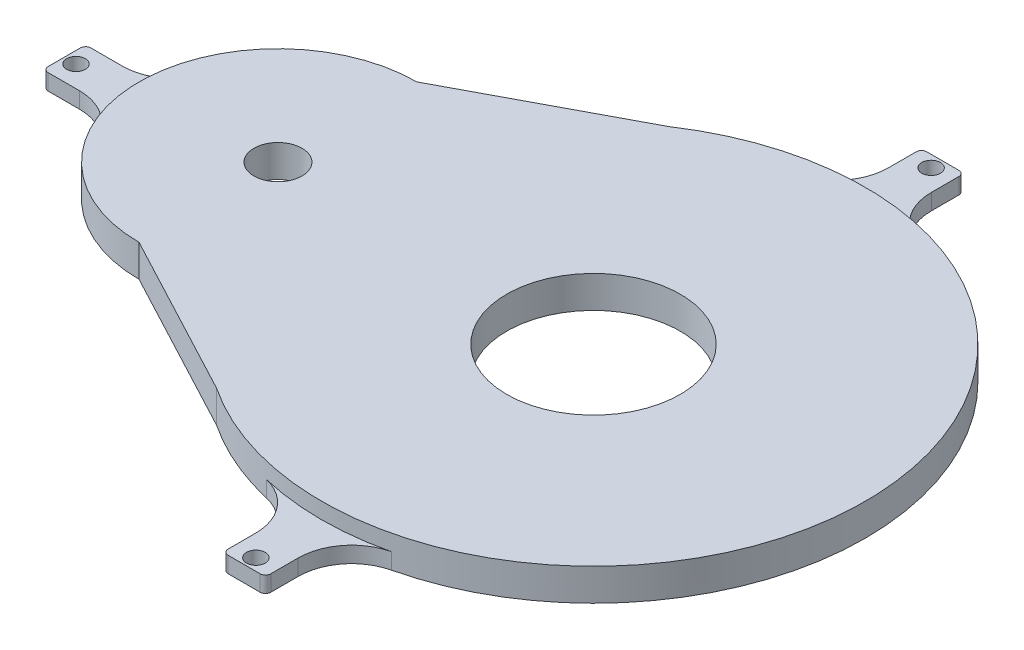
from build123d import *
from build123d.topology import SkipClean

# Parameters (mm, degrees)
SKETCH1_R           = 4.5
BOSS_EXTRUDE1_DEPTH = 6
BOSS_EXTRUDE5_DEPTH = 6
BOSS_EXTRUDE3_START = -6
BOSS_EXTRUDE3_DEPTH = 6
CUT_EXTRUDE1_START  = -3
CUT_EXTRUDE1_DEPTH  = 3
BOSS_EXTRUDE4_START = -6
BOSS_EXTRUDE4_DEPTH = 6
CUT_EXTRUDE2_START  = -3
CUT_EXTRUDE2_DEPTH  = 3
BOSS_EXTRUDE7_START = -3
BOSS_EXTRUDE7_DEPTH = 3
BOSS_EXTRUDE9_START = -6
BOSS_EXTRUDE9_DEPTH = 6
CUT_EXTRUDE4_START  = -3
CUT_EXTRUDE4_DEPTH  = 3
FILLET1_R           = 1
FILLET2_R           = 10
CUT_EXTRUDE5_START  = -6
CUT_EXTRUDE5_DEPTH  = 6
SKETCH1_6_R         = 16.25
SKETCH1_6_R_2       = 4.5
CUT_EXTRUDE8_DEPTH  = 10


with BuildPart() as part:
    # Sketch1 → Boss-Extrude1 (new body)
    with BuildSketch(Plane(origin=(0, 0, 0), x_dir=(1, 0, 0), z_dir=(0, 1, 0))):
        with BuildLine():
            Line((3.706249193, 49.435224426), (-27.146075319, 33.07485149))
            ThreePointArc((-27.146075319, 33.07485149), (-53.146075319, 7.07485149), (-27.146075319, -18.92514851))
            Line((-27.146075319, -18.92514851), (3.706249193, -35.285521446))
            ThreePointArc((3.706249193, -35.285521446), (82.798924681, 7.07485149), (3.706249193, 49.435224426))
        make_face()
        with Locations(Location((-27.146075319, 7.07485149, 0), (0, 0, 270))):
            Circle(SKETCH1_R, mode=Mode.SUBTRACT)
    extrude(amount=BOSS_EXTRUDE1_DEPTH)

    # Sketch1<3> → Boss-Extrude5 (add)
    with BuildSketch(Plane(origin=(0, 0, 0), x_dir=(1, 0, 0), z_dir=(0, 1, 0))):
        with BuildLine():
            ThreePointArc((-16.299337932, -9.227158073), (-13.7342993, -15.430441322), (-10.375107984, -21.242151909))
            Line((-10.375107984, -21.242151909), (3.706249193, -27.385705604))
            ThreePointArc((3.706249193, -27.385705604), (-5.156108472, -17.605185328), (-10.76229626, -5.656519346))
            ThreePointArc((-10.76229626, -5.656519346), (-12.682785992, -8.75689294), (-16.299337932, -9.227158073))
        make_face()
    extrude(amount=BOSS_EXTRUDE5_DEPTH)

    # Sketch2 → Boss-Extrude3 (add)
    with BuildSketch(Plane(origin=(0, 6, 0), x_dir=(1, 0, 0), z_dir=(0, 1, 0)).offset(BOSS_EXTRUDE3_START)):
        with BuildLine():
            ThreePointArc((-53.146075319, 7.07485149), (-53.068576106, 9.080830791), (-52.836540476, 11.07485149))
            Line((-52.836540476, 11.07485149), (-67.146075316, 11.07485149))
            Line((-67.146075316, 11.07485149), (-67.146075316, 7.07485149))
            Line((-67.146075316, 7.07485149), (-66.696075316, 7.07485149))
            ThreePointArc((-66.696075316, 7.07485149), (-64.946075316, 8.82485149), (-63.196075316, 7.07485149))
            Line((-63.196075316, 7.07485149), (-53.146075319, 7.07485149))
        make_face()
        with BuildLine():
            ThreePointArc((-52.836540476, 3.07485149), (-53.068576106, 5.06887219), (-53.146075319, 7.07485149))
            Line((-53.146075319, 7.07485149), (-63.196075316, 7.07485149))
            ThreePointArc((-63.196075316, 7.07485149), (-64.946075316, 5.32485149), (-66.696075316, 7.07485149))
            Line((-66.696075316, 7.07485149), (-67.146075316, 7.07485149))
            Line((-67.146075316, 7.07485149), (-67.146075316, 3.07485149))
            Line((-67.146075316, 3.07485149), (-52.836540476, 3.07485149))
        make_face()
        with BuildLine():
            Line((97.688924678, 11.07485149), (82.641479318, 11.07485149))
            ThreePointArc((82.641479318, 11.07485149), (82.759548106, 9.076400206), (82.798924681, 7.07485149))
            Line((82.798924681, 7.07485149), (93.738924678, 7.07485149))
            ThreePointArc((93.738924678, 7.07485149), (95.488924678, 8.82485149), (97.238924678, 7.07485149))
            Line((97.238924678, 7.07485149), (97.688924678, 7.07485149))
            Line((97.688924678, 7.07485149), (97.688924678, 11.07485149))
        make_face()
        with BuildLine():
            Line((93.738924678, 7.07485149), (82.798924681, 7.07485149))
            ThreePointArc((82.798924681, 7.07485149), (82.759548106, 5.073302775), (82.641479318, 3.07485149))
            Line((82.641479318, 3.07485149), (97.688924678, 3.07485149))
            Line((97.688924678, 3.07485149), (97.688924678, 7.07485149))
            Line((97.688924678, 7.07485149), (97.238924678, 7.07485149))
            ThreePointArc((97.238924678, 7.07485149), (95.488924678, 5.32485149), (93.738924678, 7.07485149))
        make_face()
    extrude(amount=BOSS_EXTRUDE3_DEPTH)

    # Sketch2<11> → Cut-Extrude1 (cut)
    with SkipClean():  # the faces are left unmerged after this step: merging them gives an invalid solid
        with BuildSketch(Plane(origin=(0, 6, 0), x_dir=(1, 0, 0), z_dir=(0, 1, 0)).offset(CUT_EXTRUDE1_START)):
            with BuildLine():
                ThreePointArc((-52.836540476, 3.07485149), (-53.068576106, 5.06887219), (-53.146075319, 7.07485149))
                Line((-53.146075319, 7.07485149), (-63.196075316, 7.07485149))
                ThreePointArc((-63.196075316, 7.07485149), (-64.946075316, 5.32485149), (-66.696075316, 7.07485149))
                Line((-66.696075316, 7.07485149), (-67.146075316, 7.07485149))
                Line((-67.146075316, 7.07485149), (-67.146075316, 3.07485149))
                Line((-67.146075316, 3.07485149), (-52.836540476, 3.07485149))
            make_face()
            with BuildLine():
                ThreePointArc((-53.146075319, 7.07485149), (-53.068576106, 9.080830791), (-52.836540476, 11.07485149))
                Line((-52.836540476, 11.07485149), (-67.146075316, 11.07485149))
                Line((-67.146075316, 11.07485149), (-67.146075316, 7.07485149))
                Line((-67.146075316, 7.07485149), (-66.696075316, 7.07485149))
                ThreePointArc((-66.696075316, 7.07485149), (-64.946075316, 8.82485149), (-63.196075316, 7.07485149))
                Line((-63.196075316, 7.07485149), (-53.146075319, 7.07485149))
            make_face()
        extrude(amount=CUT_EXTRUDE1_DEPTH, mode=Mode.SUBTRACT)

    # Sketch2<13> → Boss-Extrude4 (add)
    with SkipClean():  # the faces are left unmerged after this step: merging them gives an invalid solid
        with BuildSketch(Plane(origin=(0, 6, 0), x_dir=(1, 0, 0), z_dir=(0, 1, 0)).offset(BOSS_EXTRUDE4_START)):
            with BuildLine():
                Line((93.738924678, 7.07485149), (82.798924681, 7.07485149))
                ThreePointArc((82.798924681, 7.07485149), (82.759548106, 5.073302775), (82.641479318, 3.07485149))
                Line((82.641479318, 3.07485149), (97.688924678, 3.07485149))
                Line((97.688924678, 3.07485149), (97.688924678, 7.07485149))
                Line((97.688924678, 7.07485149), (97.238924678, 7.07485149))
                ThreePointArc((97.238924678, 7.07485149), (95.488924678, 5.32485149), (93.738924678, 7.07485149))
            make_face()
            with BuildLine():
                Line((97.688924678, 11.07485149), (82.641479318, 11.07485149))
                ThreePointArc((82.641479318, 11.07485149), (82.759548106, 9.076400206), (82.798924681, 7.07485149))
                Line((82.798924681, 7.07485149), (93.738924678, 7.07485149))
                ThreePointArc((93.738924678, 7.07485149), (95.488924678, 8.82485149), (97.238924678, 7.07485149))
                Line((97.238924678, 7.07485149), (97.688924678, 7.07485149))
                Line((97.688924678, 7.07485149), (97.688924678, 11.07485149))
            make_face()
        extrude(amount=BOSS_EXTRUDE4_DEPTH)

    # Sketch2<15> → Cut-Extrude2 (cut)
    with SkipClean():  # the faces are left unmerged after this step: merging them gives an invalid solid
        with BuildSketch(Plane(origin=(0, 6, 0), x_dir=(1, 0, 0), z_dir=(0, 1, 0)).offset(CUT_EXTRUDE2_START)):
            with BuildLine():
                Line((93.738924678, 7.07485149), (82.798924681, 7.07485149))
                ThreePointArc((82.798924681, 7.07485149), (82.759548106, 5.073302775), (82.641479318, 3.07485149))
                Line((82.641479318, 3.07485149), (97.688924678, 3.07485149))
                Line((97.688924678, 3.07485149), (97.688924678, 7.07485149))
                Line((97.688924678, 7.07485149), (97.238924678, 7.07485149))
                ThreePointArc((97.238924678, 7.07485149), (95.488924678, 5.32485149), (93.738924678, 7.07485149))
            make_face()
            with BuildLine():
                Line((97.688924678, 11.07485149), (82.641479318, 11.07485149))
                ThreePointArc((82.641479318, 11.07485149), (82.759548106, 9.076400206), (82.798924681, 7.07485149))
                Line((82.798924681, 7.07485149), (93.738924678, 7.07485149))
                ThreePointArc((93.738924678, 7.07485149), (95.488924678, 8.82485149), (97.238924678, 7.07485149))
                Line((97.238924678, 7.07485149), (97.688924678, 7.07485149))
                Line((97.688924678, 7.07485149), (97.688924678, 11.07485149))
            make_face()
        extrude(amount=CUT_EXTRUDE2_DEPTH, mode=Mode.SUBTRACT)

    # Sketch2<16> → Boss-Extrude7 (add)
    with BuildSketch(Plane(origin=(0, 6, 0), x_dir=(1, 0, 0), z_dir=(0, 1, 0)).offset(BOSS_EXTRUDE7_START)):
        with BuildLine():
            Line((93.738924678, 7.07485149), (82.798924681, 7.07485149))
            ThreePointArc((82.798924681, 7.07485149), (82.759548106, 5.073302775), (82.641479318, 3.07485149))
            Line((82.641479318, 3.07485149), (97.688924678, 3.07485149))
            Line((97.688924678, 3.07485149), (97.688924678, 7.07485149))
            Line((97.688924678, 7.07485149), (97.238924678, 7.07485149))
            ThreePointArc((97.238924678, 7.07485149), (95.488924678, 5.32485149), (93.738924678, 7.07485149))
        make_face()
        with BuildLine():
            Line((97.688924678, 11.07485149), (82.641479318, 11.07485149))
            ThreePointArc((82.641479318, 11.07485149), (82.759548106, 9.076400206), (82.798924681, 7.07485149))
            Line((82.798924681, 7.07485149), (93.738924678, 7.07485149))
            ThreePointArc((93.738924678, 7.07485149), (95.488924678, 8.82485149), (97.238924678, 7.07485149))
            Line((97.238924678, 7.07485149), (97.688924678, 7.07485149))
            Line((97.688924678, 7.07485149), (97.688924678, 11.07485149))
        make_face()
        with BuildLine():
            ThreePointArc((-53.146075319, 7.07485149), (-53.068576106, 9.080830791), (-52.836540476, 11.07485149))
            Line((-52.836540476, 11.07485149), (-67.146075316, 11.07485149))
            Line((-67.146075316, 11.07485149), (-67.146075316, 7.07485149))
            Line((-67.146075316, 7.07485149), (-66.696075316, 7.07485149))
            ThreePointArc((-66.696075316, 7.07485149), (-64.946075316, 8.82485149), (-63.196075316, 7.07485149))
            Line((-63.196075316, 7.07485149), (-53.146075319, 7.07485149))
        make_face()
        with BuildLine():
            ThreePointArc((-52.836540476, 3.07485149), (-53.068576106, 5.06887219), (-53.146075319, 7.07485149))
            Line((-53.146075319, 7.07485149), (-63.196075316, 7.07485149))
            ThreePointArc((-63.196075316, 7.07485149), (-64.946075316, 5.32485149), (-66.696075316, 7.07485149))
            Line((-66.696075316, 7.07485149), (-67.146075316, 7.07485149))
            Line((-67.146075316, 7.07485149), (-67.146075316, 3.07485149))
            Line((-67.146075316, 3.07485149), (-52.836540476, 3.07485149))
        make_face()
    extrude(amount=BOSS_EXTRUDE7_DEPTH)

    # Sketch2<19> → Boss-Extrude9 (add)
    with BuildSketch(Plane(origin=(0, 6, 0), x_dir=(1, 0, 0), z_dir=(0, 1, 0)).offset(BOSS_EXTRUDE9_START)):
        with BuildLine():
            ThreePointArc((31.908924681, -43.81514851), (29.907375966, -43.775771935), (27.908924681, -43.657703147))
            Line((27.908924681, -43.657703147), (27.908924681, -58.31514851))
            Line((27.908924681, -58.31514851), (31.908924681, -58.31514851))
            Line((31.908924681, -58.31514851), (31.908924681, -57.86514851))
            ThreePointArc((31.908924681, -57.86514851), (30.158924681, -56.11514851), (31.908924681, -54.36514851))
            Line((31.908924681, -54.36514851), (31.908924681, -43.81514851))
        make_face()
        with BuildLine():
            ThreePointArc((35.908924681, -43.657703147), (33.910473397, -43.775771935), (31.908924681, -43.81514851))
            Line((31.908924681, -43.81514851), (31.908924681, -54.36514851))
            ThreePointArc((31.908924681, -54.36514851), (33.146361548, -54.877711643), (33.658924681, -56.11514851))
            ThreePointArc((33.658924681, -56.11514851), (33.146361548, -57.352585377), (31.908924681, -57.86514851))
            Line((31.908924681, -57.86514851), (31.908924681, -58.31514851))
            Line((31.908924681, -58.31514851), (35.908924681, -58.31514851))
            Line((35.908924681, -58.31514851), (35.908924681, -43.657703147))
        make_face()
        with BuildLine():
            Line((31.908924681, 68.51485149), (31.908924681, 57.96485149))
            ThreePointArc((31.908924681, 57.96485149), (33.910473397, 57.925474916), (35.908924681, 57.807406127))
            Line((35.908924681, 57.807406127), (35.908924681, 72.46485149))
            Line((35.908924681, 72.46485149), (31.908924681, 72.46485149))
            Line((31.908924681, 72.46485149), (31.908924681, 72.01485149))
            ThreePointArc((31.908924681, 72.01485149), (33.146361548, 71.502288357), (33.658924681, 70.26485149))
            ThreePointArc((33.658924681, 70.26485149), (33.146361548, 69.027414623), (31.908924681, 68.51485149))
        make_face()
        with BuildLine():
            Line((27.908924681, 72.46485149), (27.908924681, 57.807406127))
            ThreePointArc((27.908924681, 57.807406127), (29.907375966, 57.925474916), (31.908924681, 57.96485149))
            Line((31.908924681, 57.96485149), (31.908924681, 68.51485149))
            ThreePointArc((31.908924681, 68.51485149), (30.158924681, 70.26485149), (31.908924681, 72.01485149))
            Line((31.908924681, 72.01485149), (31.908924681, 72.46485149))
            Line((31.908924681, 72.46485149), (27.908924681, 72.46485149))
        make_face()
    extrude(amount=BOSS_EXTRUDE9_DEPTH)

    # Sketch2<22> → Cut-Extrude4 (cut)
    with SkipClean():  # the faces are left unmerged after this step: merging them gives an invalid solid
        with BuildSketch(Plane(origin=(0, 6, 0), x_dir=(1, 0, 0), z_dir=(0, 1, 0)).offset(CUT_EXTRUDE4_START)):
            with BuildLine():
                ThreePointArc((35.908924681, -43.657703147), (33.910473397, -43.775771935), (31.908924681, -43.81514851))
                Line((31.908924681, -43.81514851), (31.908924681, -54.36514851))
                ThreePointArc((31.908924681, -54.36514851), (33.146361548, -54.877711643), (33.658924681, -56.11514851))
                ThreePointArc((33.658924681, -56.11514851), (33.146361548, -57.352585377), (31.908924681, -57.86514851))
                Line((31.908924681, -57.86514851), (31.908924681, -58.31514851))
                Line((31.908924681, -58.31514851), (35.908924681, -58.31514851))
                Line((35.908924681, -58.31514851), (35.908924681, -43.657703147))
            make_face()
            with BuildLine():
                ThreePointArc((31.908924681, -43.81514851), (29.907375966, -43.775771935), (27.908924681, -43.657703147))
                Line((27.908924681, -43.657703147), (27.908924681, -58.31514851))
                Line((27.908924681, -58.31514851), (31.908924681, -58.31514851))
                Line((31.908924681, -58.31514851), (31.908924681, -57.86514851))
                ThreePointArc((31.908924681, -57.86514851), (30.158924681, -56.11514851), (31.908924681, -54.36514851))
                Line((31.908924681, -54.36514851), (31.908924681, -43.81514851))
            make_face()
            with BuildLine():
                Line((31.908924681, 68.51485149), (31.908924681, 57.96485149))
                ThreePointArc((31.908924681, 57.96485149), (33.910473397, 57.925474916), (35.908924681, 57.807406127))
                Line((35.908924681, 57.807406127), (35.908924681, 72.46485149))
                Line((35.908924681, 72.46485149), (31.908924681, 72.46485149))
                Line((31.908924681, 72.46485149), (31.908924681, 72.01485149))
                ThreePointArc((31.908924681, 72.01485149), (33.146361548, 71.502288357), (33.658924681, 70.26485149))
                ThreePointArc((33.658924681, 70.26485149), (33.146361548, 69.027414623), (31.908924681, 68.51485149))
            make_face()
            with BuildLine():
                Line((27.908924681, 72.46485149), (27.908924681, 57.807406127))
                ThreePointArc((27.908924681, 57.807406127), (29.907375966, 57.925474916), (31.908924681, 57.96485149))
                Line((31.908924681, 57.96485149), (31.908924681, 68.51485149))
                ThreePointArc((31.908924681, 68.51485149), (30.158924681, 70.26485149), (31.908924681, 72.01485149))
                Line((31.908924681, 72.01485149), (31.908924681, 72.46485149))
                Line((31.908924681, 72.46485149), (27.908924681, 72.46485149))
            make_face()
            with BuildLine():
                ThreePointArc((-53.146075319, 7.07485149), (-53.068576106, 9.080830791), (-52.836540476, 11.07485149))
                Line((-52.836540476, 11.07485149), (-67.146075316, 11.07485149))
                Line((-67.146075316, 11.07485149), (-67.146075316, 7.07485149))
                Line((-67.146075316, 7.07485149), (-66.696075316, 7.07485149))
                ThreePointArc((-66.696075316, 7.07485149), (-64.946075316, 8.82485149), (-63.196075316, 7.07485149))
                Line((-63.196075316, 7.07485149), (-53.146075319, 7.07485149))
            make_face()
            with BuildLine():
                ThreePointArc((-52.836540476, 3.07485149), (-53.068576106, 5.06887219), (-53.146075319, 7.07485149))
                Line((-53.146075319, 7.07485149), (-63.196075316, 7.07485149))
                ThreePointArc((-63.196075316, 7.07485149), (-64.946075316, 5.32485149), (-66.696075316, 7.07485149))
                Line((-66.696075316, 7.07485149), (-67.146075316, 7.07485149))
                Line((-67.146075316, 7.07485149), (-67.146075316, 3.07485149))
                Line((-67.146075316, 3.07485149), (-52.836540476, 3.07485149))
            make_face()
        extrude(amount=CUT_EXTRUDE4_DEPTH, mode=Mode.SUBTRACT)

    # Fillet1
    fillet1_edges = [part.edges().sort_by_distance(p)[0] for p in [
        (35.908924681, 1.5, 58.31514851),
        (27.908924681, 1.5, 58.31514851),
        (27.908924681, 1.5, -72.46485149),
        (35.908924681, 1.5, -72.46485149),
        (-67.146075316, 1.5, -3.07485149),
        (-67.146075316, 1.5, -11.07485149),
    ]]
    fillet(fillet1_edges, radius=FILLET1_R)

    # Fillet2
    fillet2_edges = [part.edges().sort_by_distance(p)[0] for p in [
        (35.908924681, 1.5, 43.657703147),
        (27.908924681, 1.5, 43.657703147),
        (27.908924681, 1.5, -57.807406127),
        (35.908924681, 1.5, -57.807406127),
        (-52.836540476, 1.5, -3.07485149),
        (-52.836540476, 1.5, -11.07485149),
    ]]
    fillet(fillet2_edges, radius=FILLET2_R)

    # Sketch2<23> → Cut-Extrude5 (cut)
    with SkipClean():  # the faces are left unmerged after this step: merging them gives an invalid solid
        with BuildSketch(Plane(origin=(0, 6, 0), x_dir=(1, 0, 0), z_dir=(0, 1, 0)).offset(CUT_EXTRUDE5_START)):
            with BuildLine():
                Line((93.738924678, 7.07485149), (82.798924681, 7.07485149))
                ThreePointArc((82.798924681, 7.07485149), (82.759548106, 5.073302775), (82.641479318, 3.07485149))
                Line((82.641479318, 3.07485149), (97.688924678, 3.07485149))
                Line((97.688924678, 3.07485149), (97.688924678, 7.07485149))
                Line((97.688924678, 7.07485149), (97.238924678, 7.07485149))
                ThreePointArc((97.238924678, 7.07485149), (95.488924678, 5.32485149), (93.738924678, 7.07485149))
            make_face()
            with BuildLine():
                Line((97.688924678, 11.07485149), (82.641479318, 11.07485149))
                ThreePointArc((82.641479318, 11.07485149), (82.759548106, 9.076400206), (82.798924681, 7.07485149))
                Line((82.798924681, 7.07485149), (93.738924678, 7.07485149))
                ThreePointArc((93.738924678, 7.07485149), (95.488924678, 8.82485149), (97.238924678, 7.07485149))
                Line((97.238924678, 7.07485149), (97.688924678, 7.07485149))
                Line((97.688924678, 7.07485149), (97.688924678, 11.07485149))
            make_face()
        extrude(amount=CUT_EXTRUDE5_DEPTH, mode=Mode.SUBTRACT)

    # Sketch1<6> → Cut-Extrude8 (cut)
    with SkipClean():  # the faces are left unmerged after this step: merging them gives an invalid solid
        with BuildSketch(Plane(origin=(0, 0, 0), x_dir=(1, 0, 0), z_dir=(0, 1, 0))):
            with Locations(Location((31.908924681, 7.07485149, 0), (0, 0, 270))):
                Circle(SKETCH1_6_R)
            with Locations((31.908924681, 7.07485149)):
                Circle(SKETCH1_6_R_2, mode=Mode.SUBTRACT)
        extrude(amount=CUT_EXTRUDE8_DEPTH, mode=Mode.SUBTRACT)


with BuildPart() as cut_extrude8_kept_piece:
    # of the separate pieces the step leaves, the one the design keeps (cut_extrude8_pieces_kept)
    add(part.part.solids().sort_by_distance((35.908924681, 0, -66.333539461))[0])


solid = cut_extrude8_kept_piece.part
